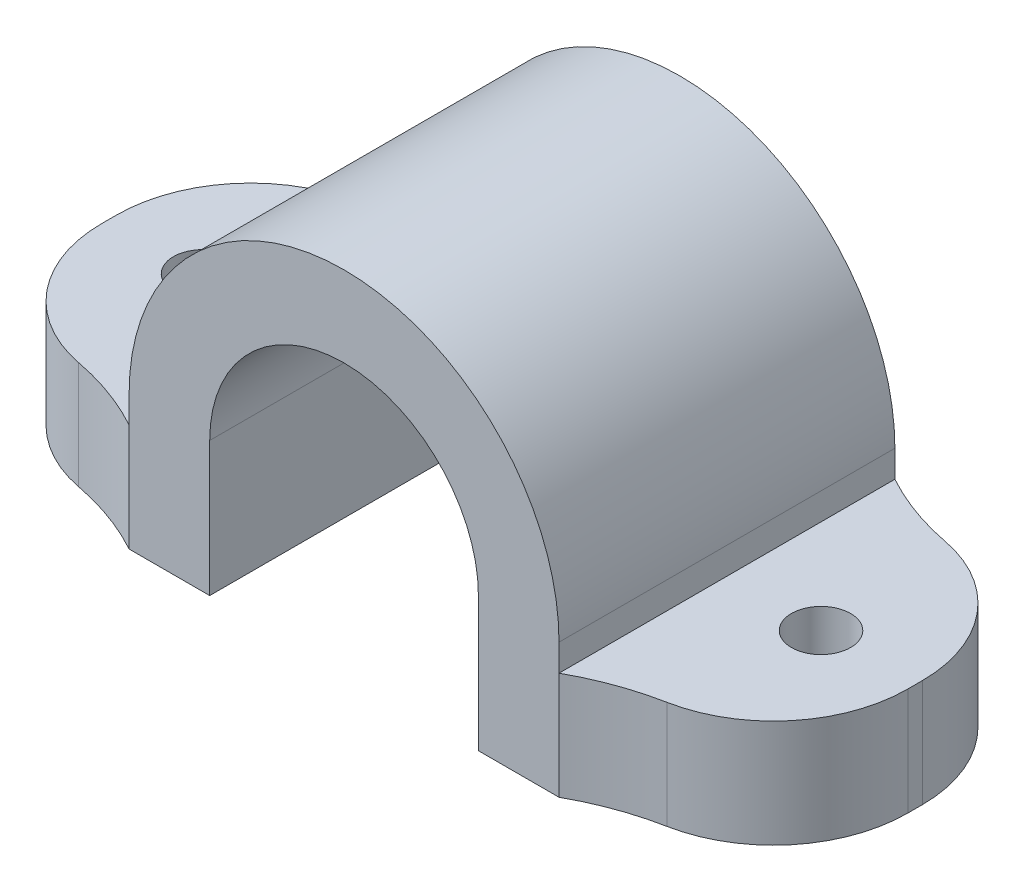
from build123d import *

# Parameters (mm, degrees)
BOSS_EXTRUDE1_DEPTH = 6.25
BOSS_EXTRUDE4_REACH = 29.149
SKETCH5_W           = 10
SKETCH5_H           = 4
FILLET1_R           = 10
FILLET2_R           = 5
SKETCH7_R           = 1.1
CUT_EXTRUDE2_DEPTH  = 19.575858103
FILLET6_R           = 10
FILLET7_R           = 5


with BuildPart() as part:
    # Sketch1 → Boss-Extrude1 (new, symmetric)
    with BuildSketch(Plane.XY):
        with BuildLine():
            Line((5, 5), (5, 0))
            Line((5, 0), (8, 0))
            Line((8, 0), (8, 5))
            ThreePointArc((8, 5), (0, 13), (-8, 5))
            Line((-8, 5), (-8, 0))
            Line((-8, 0), (-5, 0))
            Line((-5, 0), (-5, 5))
            ThreePointArc((-5, 5), (0, 10), (5, 5))
        make_face()
    extrude(amount=BOSS_EXTRUDE1_DEPTH, both=True)

    # Sketch5 → Boss-Extrude4 (add, up to next)
    with BuildSketch(Plane(origin=(-15, 0, 0), x_dir=(0, 0, -1), z_dir=(1, 0, 0)), mode=Mode.PRIVATE) as boss_extrude4_sk1:
        with Locations((0, 2)):
            Rectangle(SKETCH5_W, SKETCH5_H)
    boss_extrude4_tool1 = extrude(boss_extrude4_sk1.sketch, amount=BOSS_EXTRUDE4_REACH, mode=Mode.PRIVATE) - part.part
    boss_extrude4 = boss_extrude4_tool1.solids().sort_by_distance((-15, 2, 0))[0]
    add(boss_extrude4)

    # Fillet1
    # the kernel refuses this fillet: 10 mm, written as the material it adds along each edge
    with BuildSketch(Plane(origin=(-8, 0, -5), x_dir=(0, 0, -1), z_dir=(0, 1, 0)), Plane(origin=(-8, 4, 5), x_dir=(0, 0, 1), z_dir=(0, -1, 0))) as fillet1_piece_1:
        with BuildLine():
            CenterArc((10, 4.841229183), FILLET1_R, 180, 28.955024372)
            Line((0, 4.841229183), (-0.2, 4.841229183))
            Line((-0.2, 4.841229183), (-0.2, 0))
            Line((-0.2, 0), (0, -0.2))
            ThreePointArc((0, -0.2), (0.625, -0.2), (1.075, -0.096824584))
            Line((1.075, -0.096824584), (1.25, 0))
        make_face()
    extrude(amount=4)

    # Fillet2
    fillet2_edges = [part.edges().sort_by_distance(p)[0] for p in [
        (-15, 2, -5),
        (-15, 2, 5),
    ]]
    fillet(fillet2_edges, radius=FILLET2_R)

    # Sketch7 → Cut-Extrude2 (cut, through all)
    with BuildSketch(Plane(origin=(0, 4, 0), x_dir=(1, 0, 0), z_dir=(0, 1, 0))):
        with Locations(Location((-11.5, 0, 0), (0, 0, 270))):
            Circle(SKETCH7_R)
    cut_extrude2 = extrude(amount=-CUT_EXTRUDE2_DEPTH, mode=Mode.SUBTRACT)

    # Mirror6: Boss-Extrude4 across plane
    add(boss_extrude4.mirror(Plane(origin=(0, 0, 0), x_dir=(0, 0, 1), z_dir=(1, 0, 0))))

    # Mirror7: Cut-Extrude2 across plane
    add(cut_extrude2.mirror(Plane(origin=(0, 0, 0), x_dir=(0, 0, 1), z_dir=(1, 0, 0))), mode=Mode.SUBTRACT)

    # Fillet6
    # the kernel refuses this fillet: 10 mm, written as the material it adds along each edge
    with BuildSketch(Plane(origin=(8, 4, 5), x_dir=(0, 0, 1), z_dir=(0, -1, 0)), Plane(origin=(8, 0, -5), x_dir=(0, 0, -1), z_dir=(0, 1, 0))) as fillet6_piece_1:
        with BuildLine():
            CenterArc((10, -4.841229183), FILLET6_R, 151.044975628, 28.955024372)
            Line((0, -4.841229183), (-0.2, -4.841229183))
            Line((-0.2, -4.841229183), (-0.2, 0))
            Line((-0.2, 0), (0, 0.2))
            ThreePointArc((0, 0.2), (0.625, 0.2), (1.075, 0.096824584))
            Line((1.075, 0.096824584), (1.25, 0))
        make_face()
    extrude(amount=4)

    # Fillet7
    fillet7_edges = [part.edges().sort_by_distance(p)[0] for p in [
        (15, 2, 5),
        (15, 2, -5),
    ]]
    fillet(fillet7_edges, radius=FILLET7_R)


solid = part.part
